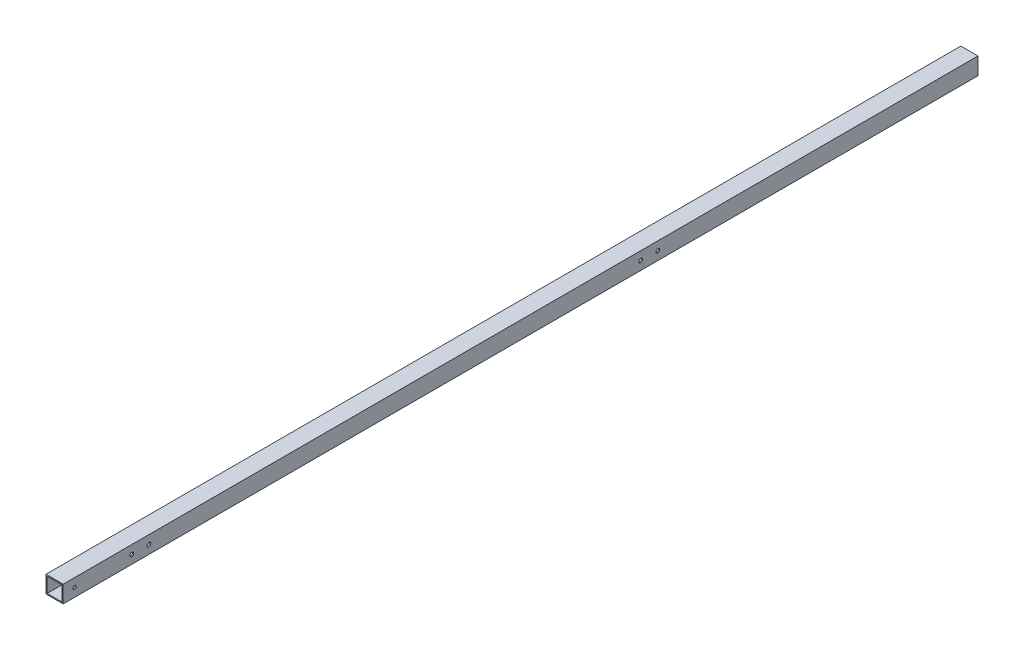
from build123d import *

# Parameters (mm, degrees)
SKETCH_1_W          = 15
SKETCH_1_H          = 15
SKETCH_1_W_2        = 13
SKETCH_1_H_2        = 13
EXTRUDE_1_DEPTH     = 800
SKETCH_4_R          = 1.5
CUT_EXTRUDE_3_DEPTH = 801.281200579
SKETCH_5_R          = 1.65
CUT_EXTRUDE_4_DEPTH = 801.281200579


with BuildPart() as part:
    # 草图1 → 拉伸-薄壁1 (new body)
    with BuildSketch(Plane.XY):
        with Locations((7.5, -7.5)):
            Rectangle(SKETCH_1_W, SKETCH_1_H)
        with Locations((7.5, -7.5)):
            Rectangle(SKETCH_1_W_2, SKETCH_1_H_2, mode=Mode.SUBTRACT)
    extrude(amount=EXTRUDE_1_DEPTH)

    # 草图4 → 切除-拉伸3 (cut, through all)
    with BuildSketch(Plane(origin=(15, 0, 0), x_dir=(0, 0, -1), z_dir=(1, 0, 0))):
        with Locations((-790, -7.5)):
            Circle(SKETCH_4_R)
    extrude(amount=-CUT_EXTRUDE_3_DEPTH, mode=Mode.SUBTRACT)

    # 草图5 → 切除-拉伸4 (cut, through all)
    with BuildSketch(Plane(origin=(15, 0, 0), x_dir=(0, 0, -1), z_dir=(1, 0, 0))):
        with Locations((-280, -7.5)):
            Circle(SKETCH_5_R)
        with Locations((-295, -7.5)):
            Circle(SKETCH_5_R)
        with Locations((-725, -7.5)):
            Circle(SKETCH_5_R)
        with Locations((-740, -7.5)):
            Circle(SKETCH_5_R)
    extrude(amount=-CUT_EXTRUDE_4_DEPTH, mode=Mode.SUBTRACT)


solid = part.part
